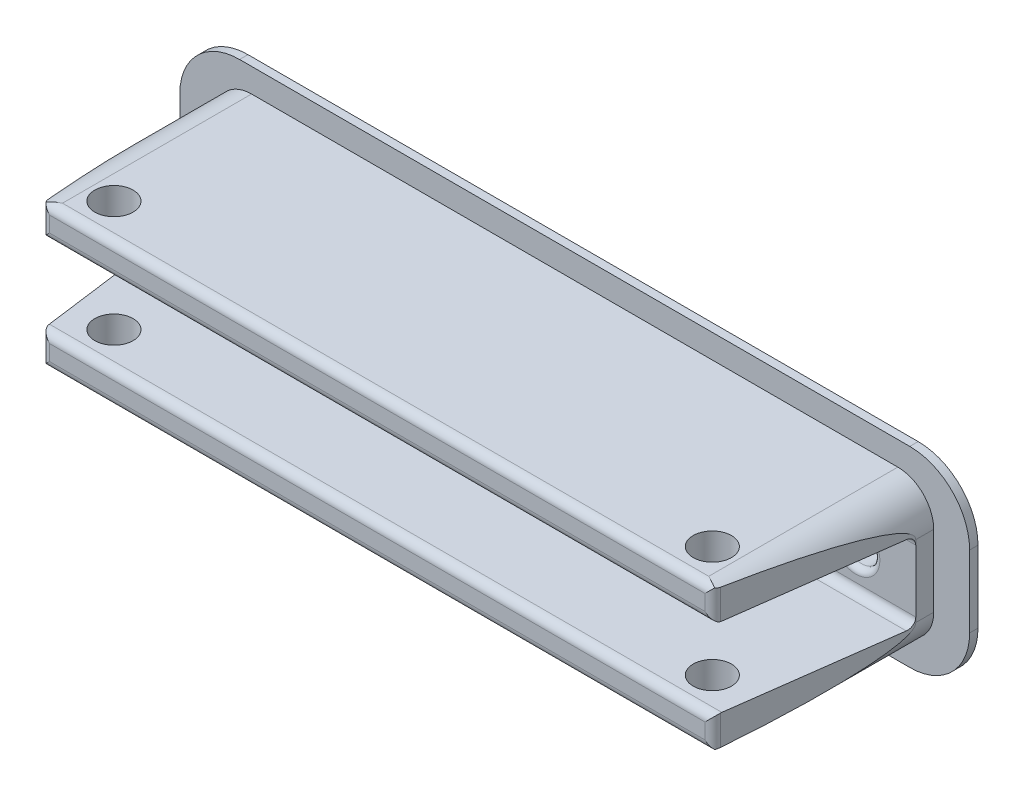
from build123d import *

# Parameters (mm, degrees)
SKETCH1_W           = 60
SKETCH1_H           = 12
BOSS_EXTRUDE1_DEPTH = 18.5
SKETCH2_W           = 65
SKETCH2_H           = 6.6
CUT_EXTRUDE1_DEPTH  = 15
SKETCH3_R           = 1.6
CUT_EXTRUDE2_DEPTH  = 38.232378382
CUT_EXTRUDE3_DEPTH  = 37.451886097
FILLET1_R           = 0.7
FILLET3_R           = 0.7
FILLET4_R           = 3
SKETCH5_R           = 1.5
CUT_EXTRUDE4_DEPTH  = 35.073450224
FILLET5_R           = 0.5
SKETCH6_W           = 73.746826028
SKETCH6_H           = 28.597179554
CUT_EXTRUDE5_DEPTH  = 2
SKETCH8_R           = 1.5
BOSS_EXTRUDE2_DEPTH = 0.7


with BuildPart() as part:
    # Sketch1 → Boss-Extrude1 (new body)
    with BuildSketch(Plane.XY):
        Rectangle(SKETCH1_W, SKETCH1_H)
    extrude(amount=BOSS_EXTRUDE1_DEPTH)

    # Sketch2 → Cut-Extrude1 (cut)
    with BuildSketch(Plane.XY.offset(18.5)):
        Rectangle(SKETCH2_W, SKETCH2_H)
    extrude(amount=-CUT_EXTRUDE1_DEPTH, mode=Mode.SUBTRACT)

    # Sketch3 → Cut-Extrude2 (cut, through all)
    with BuildSketch(Plane(origin=(0, 6, 0), x_dir=(1, 0, 0), z_dir=(0, 1, 0))):
        with Locations(Location((25, -15.5, 0), (0, 0, 180))):
            Circle(SKETCH3_R)
        with Locations(Location((-25, -15.5, 0), (0, 0, 180))):
            Circle(SKETCH3_R)
    extrude(amount=-CUT_EXTRUDE2_DEPTH, mode=Mode.SUBTRACT)

    # Sketch4 → Cut-Extrude3 (cut, symmetric)
    with BuildSketch(Plane(origin=(0, -3.3, 0), x_dir=(1, 0, 0), z_dir=(0, 1, 0))):
        Polygon((-30, -3.5), (-28, -18.5), (-30, -18.5), align=None)
    cut_extrude3 = extrude(amount=CUT_EXTRUDE3_DEPTH, both=True, mode=Mode.SUBTRACT)

    # Mirror1: Cut-Extrude3 across plane
    add(cut_extrude3.mirror(Plane(origin=(0, 0, 0), x_dir=(0, 0, 1), z_dir=(1, 0, 0))), mode=Mode.SUBTRACT)

    # Fillet1
    fillet1_edges = [part.edges().sort_by_distance(p)[0] for p in [
        (0, 3.3, 3.5),
        (0, -3.3, 3.5),
    ]]
    fillet(fillet1_edges, radius=FILLET1_R)

    # Fillet3
    fillet3_edges = [part.edges().sort_by_distance(p)[0] for p in [
        (0, -3.3, 18.5),
        (0, -6, 18.5),
        (-28, 4.65, 18.5),
        (-28, -4.65, 18.5),
        (0, 3.3, 18.5),
        (0, 6, 18.5),
        (28, 4.65, 18.5),
        (28, -4.65, 18.5),
    ]]
    fillet(fillet3_edges, radius=FILLET3_R)

    # Fillet4
    # the kernel refuses this fillet: 3 mm, written as the material it takes off along each edge
    with BuildSketch(Plane(origin=(30, -6, -18), x_dir=(-1, 0, 0), z_dir=(0, 0, 1)), Plane(origin=(-30, -6, -18), x_dir=(0, 1, 0), z_dir=(0, 0, 1))) as fillet4_piece_1:
        with BuildLine():
            CenterArc((FILLET4_R, -FILLET4_R), FILLET4_R, 90, 90)
            Line((0, -FILLET4_R), (-FILLET4_R * 0.02, -FILLET4_R))
            Line((-FILLET4_R * 0.02, -FILLET4_R), (-FILLET4_R * 0.02, FILLET4_R * 0.02))
            Line((-FILLET4_R * 0.02, FILLET4_R * 0.02), (FILLET4_R, FILLET4_R * 0.02))
            Line((FILLET4_R, FILLET4_R * 0.02), (FILLET4_R, 0))
        make_face()
    extrude(amount=39.5, mode=Mode.SUBTRACT)
    with BuildSketch(Plane(origin=(30, 6, -18), x_dir=(-1, 0, 0), z_dir=(0, 0, 1)), Plane(origin=(-30, 6, -18), x_dir=(0, -1, 0), z_dir=(0, 0, 1))) as fillet4_piece_2:
        with BuildLine():
            CenterArc((FILLET4_R, FILLET4_R), FILLET4_R, 180, 90)
            Line((0, FILLET4_R), (-FILLET4_R * 0.02, FILLET4_R))
            Line((-FILLET4_R * 0.02, FILLET4_R), (-FILLET4_R * 0.02, -FILLET4_R * 0.02))
            Line((-FILLET4_R * 0.02, -FILLET4_R * 0.02), (FILLET4_R, -FILLET4_R * 0.02))
            Line((FILLET4_R, -FILLET4_R * 0.02), (FILLET4_R, 0))
        make_face()
    extrude(amount=39.5, mode=Mode.SUBTRACT)

    # Sketch5 → Cut-Extrude4 (cut, through all)
    with BuildSketch(Plane.XY.offset(3.5)):
        with Locations((-25, 0)):
            Circle(SKETCH5_R)
        with Locations((25, 0)):
            Circle(SKETCH5_R)
    extrude(amount=-CUT_EXTRUDE4_DEPTH, mode=Mode.SUBTRACT)

    # Fillet5
    fillet5_edges = [part.edges().sort_by_distance(p)[0] for p in [
        (-26.5, 0, 3.5),
        (23.5, 0, 3.5),
    ]]
    fillet(fillet5_edges, radius=FILLET5_R)

    # Sketch6 → Cut-Extrude5 (cut)
    with BuildSketch(Plane.XY):
        Rectangle(SKETCH6_W, SKETCH6_H)
    extrude(amount=CUT_EXTRUDE5_DEPTH, mode=Mode.SUBTRACT)

    # Sketch8 → Boss-Extrude2 (add)
    with BuildSketch(Plane(origin=(0, 0, 2), x_dir=(-1, 0, 0), z_dir=(0, 0, -1))):
        with BuildLine():
            Line((28, -8), (-28, -8))
            ThreePointArc((-28, -8), (-31.535533906, -6.535533906), (-33, -3))
            Line((-33, -3), (-33, 3))
            ThreePointArc((-33, 3), (-31.535533906, 6.535533906), (-28, 8))
            Line((-28, 8), (28, 8))
            ThreePointArc((28, 8), (31.535533906, 6.535533906), (33, 3))
            Line((33, 3), (33, -3))
            ThreePointArc((33, -3), (31.535533906, -6.535533906), (28, -8))
        make_face()
        with Locations(Location((-25, 0, 0), (0, 0, 180))):
            Circle(SKETCH8_R, mode=Mode.SUBTRACT)
        with Locations(Location((25, 0, 0), (0, 0, 180))):
            Circle(SKETCH8_R, mode=Mode.SUBTRACT)
    extrude(amount=BOSS_EXTRUDE2_DEPTH)


solid = part.part
